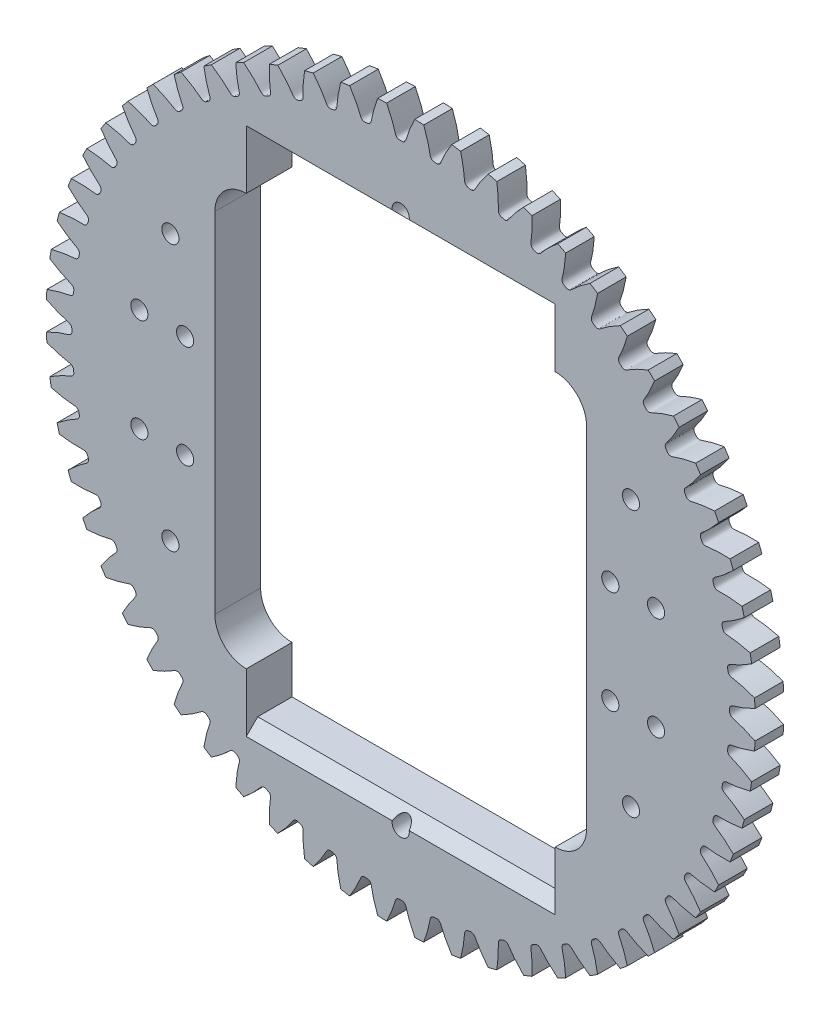
from build123d import *

# Parameters (mm, degrees)
SKETCH_487_W               = 5
SKETCH_487_H               = 61.999999069
CUT_EXTRUDE_661_DEPTH      = 3
PATTERN_CIRCULAR_714_COUNT = 60
SKETCH_761_W               = 6
SKETCH_761_H               = 5
SKETCH_17_R                = 52.5
EXTRUDE_1_DEPTH            = 3
SKETCH_5_W                 = 54
SKETCH_5_H                 = 88.5
CUT_EXTRUDE_2_DEPTH        = 88.976681839
CHAMFER_3_SIZE             = 2
SKETCH_9_R                 = 1.5
CUT_EXTRUDE_4_DEPTH        = 88.976681839
SKETCH_12_W                = 65
SKETCH_12_H                = 72
CUT_EXTRUDE_5_DEPTH        = 88.976681839
FILLET_1_R                 = 5.5
SKETCH_18_R                = 1.5
CUT_EXTRUDE_7_DEPTH        = 20


with BuildPart() as part:
    # Sketch 487 → Revolve 545 (revolve)
    with BuildSketch(Plane(origin=(0, 0, 0), x_dir=(0, 0, -1), z_dir=(1, 0, 0)), mode=Mode.PRIVATE) as revolve_545_sk:
        with Locations((0.5, 30.999999535)):
            Rectangle(SKETCH_487_W, SKETCH_487_H)
    revolve(revolve_545_sk.sketch.rotate(Axis((0, 0, 0), (0, 0, -1)), 90), axis=Axis((0, 0, 0), (0, 0, -1)))

    # Sketch 590 → Cut-Extrude 661 (cut, symmetric)
    with BuildSketch(Plane.XY):
        with BuildLine():
            ThreePointArc((62.049255851, 2.509926796), (62.099999067, 0), (62.049255851, -2.509926796))
            add(Edge.make_bspline(
                [(62.049255851, -2.509926796), (61.880774363, -2.42372043), (61.629794464, -2.298732862), (61.29662876, -2.139816099), (61.055024281, -2.027869972), (60.818607345, -1.921520159), (60.587472064, -1.820636381), (60.361710284, -1.725086927), (60.141411554, -1.634738759), (59.926663147, -1.549457421), (59.717549896, -1.469107472), (59.51415471, -1.393551138), (59.316556634, -1.32265325), (59.124837685, -1.256263869), (58.939058527, -1.19428005), (58.759344467, -1.136427448), (58.585581703, -1.083031762), (58.340485726, -1.008618001), (58.121549601, -0.958050249), (57.942577735, -0.880548959), (57.862637376, -0.837879961), (57.777682986, -0.780806545), (57.686307169, -0.699856633), (57.593275308, -0.581506122), (57.520013207, -0.42053531), (57.492130182, -0.218013548), (57.504285903, 0), (57.492130182, 0.218013548), (57.520013207, 0.42053531), (57.593275308, 0.581506122), (57.686307169, 0.699856633), (57.777682986, 0.780806545), (57.862637376, 0.837879961), (57.942577735, 0.880548959), (58.121549601, 0.958050249), (58.340485726, 1.008618001), (58.585581703, 1.083031762), (58.759344467, 1.136427448), (58.939058527, 1.19428005), (59.124837685, 1.256263869), (59.316556634, 1.32265325), (59.51415471, 1.393551138), (59.717549896, 1.469107472), (59.926663147, 1.549457421), (60.141411554, 1.634738759), (60.361710284, 1.725086927), (60.587472064, 1.820636381), (60.818607345, 1.921520159), (61.055024281, 2.027869972), (61.29662876, 2.139816099), (61.629794464, 2.298732862), (61.880774363, 2.42372043), (62.049255851, 2.509926796)],
                knots=[0, 0, 0, 0, 0.05176586, 0.076685537, 0.100963046, 0.124598386, 0.147591557, 0.16994256, 0.191651394, 0.21271806, 0.233142557, 0.252924885, 0.272065045, 0.290563036, 0.308418859, 0.325632513, 0.342203998, 0.358133315, 0.395728589, 0.403326908, 0.411414611, 0.420483419, 0.431260975, 0.444674611, 0.46138654, 0.478964563, 0.5, 0.521035437, 0.53861346, 0.555325389, 0.568739025, 0.579516581, 0.588585389, 0.596673092, 0.604271411, 0.641866685, 0.657796002, 0.674367487, 0.691581141, 0.709436964, 0.727934955, 0.747075115, 0.766857443, 0.78728194, 0.808348606, 0.83005744, 0.852408443, 0.875401614, 0.899036954, 0.923314463, 0.94823414, 1, 1, 1, 1], degree=3))
        make_face()
    cut_extrude_661 = extrude(amount=CUT_EXTRUDE_661_DEPTH, both=True, mode=Mode.SUBTRACT)

    # Pattern Circular 714: Cut-Extrude 661 ×60 about axis
    pattern_circular_714_axis = Axis((0, 0, 55), (0, 0, -1))
    for i in range(1, PATTERN_CIRCULAR_714_COUNT):
        add(cut_extrude_661.rotate(pattern_circular_714_axis, i * 360 / PATTERN_CIRCULAR_714_COUNT), mode=Mode.SUBTRACT)

    # Sketch 761 → Cut-Revolve 802 (revolve, cut)
    with BuildSketch(Plane(origin=(0, 0, 0), x_dir=(0, 0, -1), z_dir=(1, 0, 0)), mode=Mode.PRIVATE) as cut_revolve_802_sk:
        with Locations((0, 2.5)):
            Rectangle(SKETCH_761_W, SKETCH_761_H)
    revolve(cut_revolve_802_sk.sketch.rotate(Axis((0, 0, 0), (0, 0, -1)), 90), axis=Axis((0, 0, 0), (0, 0, -1)), mode=Mode.SUBTRACT)

    # 草图17 → 凸台-拉伸1 (add)
    with BuildSketch(Plane(origin=(0, 0, -3), x_dir=(-1, 0, 0), z_dir=(0, 0, -1))):
        with Locations(Location((0, 0, 0), (0, 0, 180))):
            Circle(SKETCH_17_R)
    extrude(amount=EXTRUDE_1_DEPTH)

    # 草图5 → 切除-拉伸2 (cut, through all)
    with BuildSketch(Plane.XY.offset(2)):
        Rectangle(SKETCH_5_W, SKETCH_5_H)
    extrude(amount=-CUT_EXTRUDE_2_DEPTH, mode=Mode.SUBTRACT)

    # 倒角3
    chamfer_3_edges = [part.edges().sort_by_distance(p)[0] for p in [
        (0, 44.25, 2),
        (0, -44.25, 2),
    ]]
    chamfer(chamfer_3_edges, length=CHAMFER_3_SIZE)

    # 草图9 → 切除-拉伸4 (cut, through all)
    with BuildSketch(Plane.XY.offset(2)):
        with Locations((0, 46.5)):
            Circle(SKETCH_9_R)
        with Locations((40.270181276, 23.25)):
            Circle(SKETCH_9_R)
        with Locations((40.270181276, -23.25)):
            Circle(SKETCH_9_R)
        with Locations((0, -46.5)):
            Circle(SKETCH_9_R)
        with Locations((-40.270181276, -23.25)):
            Circle(SKETCH_9_R)
        with Locations((-40.270181276, 23.25)):
            Circle(SKETCH_9_R)
    extrude(amount=-CUT_EXTRUDE_4_DEPTH, mode=Mode.SUBTRACT)

    # 草图12 → 切除-拉伸5 (cut, through all)
    with BuildSketch(Plane.XY.offset(2)):
        Rectangle(SKETCH_12_W, SKETCH_12_H)
    extrude(amount=-CUT_EXTRUDE_5_DEPTH, mode=Mode.SUBTRACT)

    # 圆角1
    fillet_1_edges = [part.edges().sort_by_distance(p)[0] for p in [
        (-32.5, 36, -2),
        (32.5, -36, -2),
        (32.5, 36, -2),
        (-32.5, -36, -2),
    ]]
    fillet(fillet_1_edges, radius=FILLET_1_R - 0.0001)  # a hair under: the kernel refuses the full size

    # 草图18 → 切除-拉伸7 (cut)
    with BuildSketch(Plane(origin=(90.573916545, -197.95666402, 2), x_dir=(0.9918515590673906, -0.12739891983681217, 0), z_dir=(0, 0, 1))):
        with Locations(Location((-161.529552035, 187.909140098, 0), (0, 0, 7.319311568))):
            Circle(SKETCH_18_R)
        with Locations(Location((-153.594739562, 188.928331456, 0), (0, 0, 7.319311568))):
            Circle(SKETCH_18_R)
        with Locations(Location((-159.236371478, 170.055812034, 0), (0, 0, 7.319311568))):
            Circle(SKETCH_18_R)
        with Locations(Location((-151.301559005, 171.075003393, 0), (0, 0, 7.319311568))):
            Circle(SKETCH_18_R)
        with Locations(Location((-79.850576146, 198.400441146, 0), (0, 0, 7.319311568))):
            Circle(SKETCH_18_R)
        with Locations(Location((-71.915763673, 199.419632505, 0), (0, 0, 7.319311568))):
            Circle(SKETCH_18_R)
        with Locations(Location((-77.557395589, 180.547113083, 0), (0, 0, 7.319311568))):
            Circle(SKETCH_18_R)
        with Locations(Location((-69.622583116, 181.566304442, 0), (0, 0, 7.319311568))):
            Circle(SKETCH_18_R)
    extrude(amount=-CUT_EXTRUDE_7_DEPTH, mode=Mode.SUBTRACT)


solid = part.part
